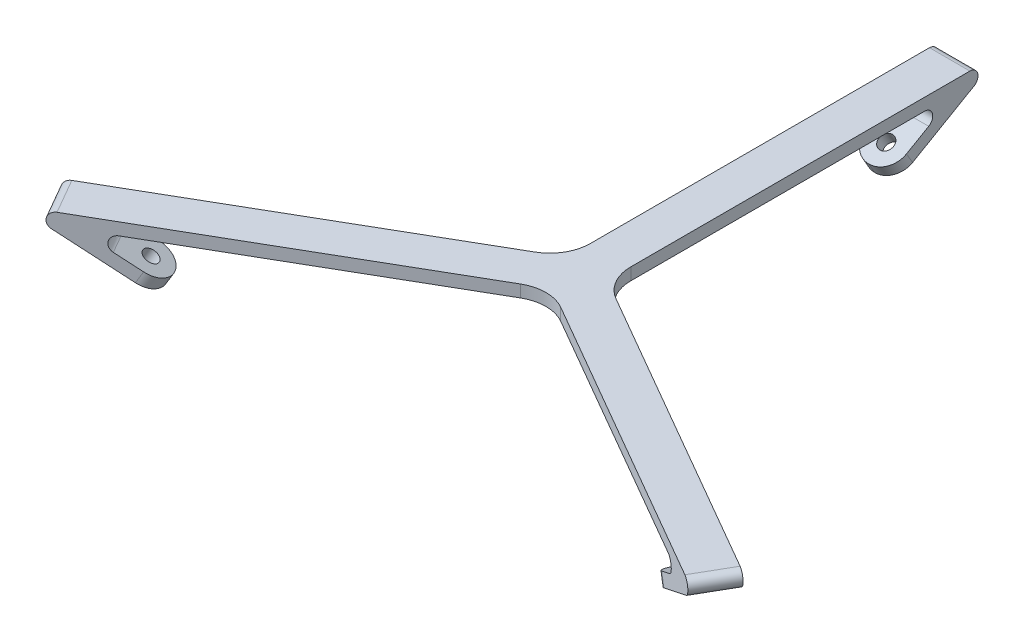
from build123d import *

# Parameters (mm, degrees)
BOSS_EXTRUDE1_DEPTH      = 15
CUT_EXTRUDE1_REACH       = 103.612
M3_CLEARANCE_HOLE1_D     = 3.6
M3_CLEARANCE_HOLE1_DEPTH = 3
CUT_EXTRUDE2_REACH       = 103.612
CIRPATTERN1_COUNT        = 3
FILLET1_R                = 2
FILLET2_R                = 10
FILLET3_R                = 5


with BuildPart() as part:
    # Sketch2 → Boss-Extrude1 (new body)
    with BuildSketch(Plane(origin=(0, 0, 0), x_dir=(1, 0, 0), z_dir=(0, 1, 0))):
        Polygon((0, 0), (-5, 2.886751346), (-5, 100), (5, 100), (5, 2.886751346), align=None)
    boss_extrude1 = extrude(amount=BOSS_EXTRUDE1_DEPTH)

    # Sketch3 → Cut-Extrude1 (cut, up to next)
    with BuildSketch(Plane(origin=(5, 0, 0), x_dir=(0, 0, -1), z_dir=(1, 0, 0)), mode=Mode.PRIVATE) as cut_extrude1_sk1:
        Polygon((0, 12), (88.803847577, 12), (68.019237886, 0), (0, 0), align=None)
    cut_extrude1_tool1 = extrude(cut_extrude1_sk1.sketch, amount=-CUT_EXTRUDE1_REACH, mode=Mode.PRIVATE) & part.part
    # Sketch3 → Cut-Extrude1 (cut, up to next)
    with BuildSketch(Plane(origin=(5, 0, 0), x_dir=(0, 0, -1), z_dir=(1, 0, 0)), mode=Mode.PRIVATE) as cut_extrude1_sk2:
        Polygon((100, 15), (74.019237886, 0), (100, 0), align=None)
    cut_extrude1_tool2 = extrude(cut_extrude1_sk2.sketch, amount=-CUT_EXTRUDE1_REACH, mode=Mode.PRIVATE) & part.part
    cut_extrude1_1 = cut_extrude1_tool1.solids().sort_by_distance((5, 6.265071, -39.435329))[0]
    add(cut_extrude1_1, mode=Mode.SUBTRACT)
    cut_extrude1_2 = cut_extrude1_tool2.solids().sort_by_distance((5, 5, -91.339746))[0]
    add(cut_extrude1_2, mode=Mode.SUBTRACT)
    cut_extrude1 = cut_extrude1_1 + cut_extrude1_2  # Cut-Extrude1 as one shape, for the pattern or mirror that repeats it

    # M3 Clearance Hole1
    with Locations(Plane(origin=(0, -32.051270189, -18.504809472), x_dir=(1, 0, 0), z_dir=(0, -0.8660254037844417, -0.49999999999999484))):
        with Locations((0, -69.102540378)):
            m3_clearance_hole1 = Hole(M3_CLEARANCE_HOLE1_D / 2, depth=M3_CLEARANCE_HOLE1_DEPTH)

    # Sketch6 → Cut-Extrude2 (cut, up to next)
    with BuildSketch(Plane(origin=(5, 0, 0), x_dir=(0, 0, -1), z_dir=(1, 0, 0)), mode=Mode.PRIVATE) as cut_extrude2_sk1:
        Polygon((74.019237886, 0), (68.019237886, 0), (72.519237886, 2.598076211), align=None)
    cut_extrude2_tool1 = extrude(cut_extrude2_sk1.sketch, amount=-CUT_EXTRUDE2_REACH, mode=Mode.PRIVATE) & part.part
    cut_extrude2 = cut_extrude2_tool1.solids().sort_by_distance((5, 0.866025, -71.519238))[0]
    add(cut_extrude2, mode=Mode.SUBTRACT)

    # CirPattern1: Boss-Extrude1, Cut-Extrude1, M3 Clearance Hole1, Cut-Extrude2 ×3 about axis
    cirpattern1_axis = Axis((0, 0, 0), (0, 1, 0))
    add([boss_extrude1.rotate(cirpattern1_axis, i * 360 / CIRPATTERN1_COUNT) for i in range(1, CIRPATTERN1_COUNT)])
    add([cut_extrude1.rotate(cirpattern1_axis, i * 360 / CIRPATTERN1_COUNT) for i in range(1, CIRPATTERN1_COUNT)], mode=Mode.SUBTRACT)
    add([m3_clearance_hole1.rotate(cirpattern1_axis, i * 360 / CIRPATTERN1_COUNT) for i in range(1, CIRPATTERN1_COUNT)], mode=Mode.SUBTRACT)
    add([cut_extrude2.rotate(cirpattern1_axis, i * 360 / CIRPATTERN1_COUNT) for i in range(1, CIRPATTERN1_COUNT)], mode=Mode.SUBTRACT)

    # Fillet1
    fillet1_edges = [part.edges().sort_by_distance(p)[0] for p in [
        (76.906387956, 12, 44.401923789),
        (-76.906387956, 12, 44.401923789),
        (0, 15, -100),
        (0, 12, -88.803847577),
        (-86.602540378, 15, 50),
        (86.602540378, 15, 50),
    ]]
    fillet(fillet1_edges, radius=FILLET1_R)

    # Fillet2
    fillet2_edges = [part.edges().sort_by_distance(p)[0] for p in [
        (0, 13.5, 5.773502692),
        (-5, 13.5, -2.886751346),
        (5, 13.5, -2.886751346),
    ]]
    fillet(fillet2_edges, radius=FILLET2_R)

    # Fillet3
    fillet3_edges = [part.edges().sort_by_distance(p)[0] for p in [
        (65.953021326, 1.299038106, 32.304491924),
        (60.953021326, 1.299038106, 40.964745962),
        (-60.953021326, 1.299038106, 40.964745962),
        (-65.953021326, 1.299038106, 32.304491924),
        (-5, 1.299038106, -73.269237886),
        (5, 1.299038106, -73.269237886),
    ]]
    fillet(fillet3_edges, radius=FILLET3_R - 0.0001)  # a hair under: the kernel refuses the full size


solid = part.part
